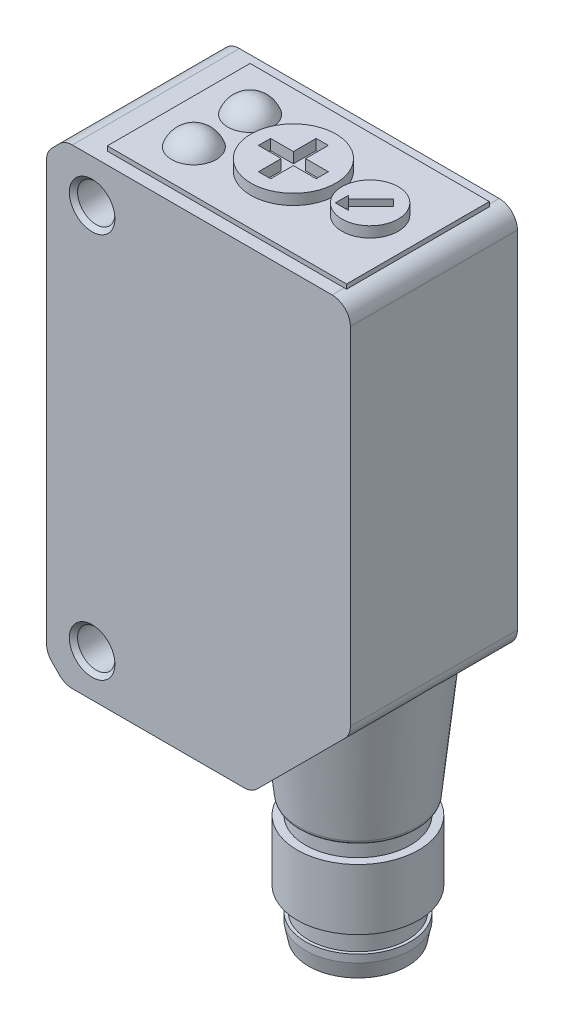
from build123d import *
from build123d.topology import SkipClean

# Parameters (mm, degrees)
BOSS_EXTRUDE1_DEPTH = 11
SKETCH3_R           = 2.9
SKETCH3_R_2         = 0.5
CUT_EXTRUDE1_DEPTH  = 4
SKETCH4_W           = 15.75
SKETCH4_H           = 9.4
BOSS_EXTRUDE2_DEPTH = 1
SKETCH5_W           = 15.75
SKETCH5_H           = 9.4
SKETCH5_R           = 1.85
SKETCH5_R_2         = 2.8
CUT_EXTRUDE2_DEPTH  = 1
SKETCH6_W           = 15.75
SKETCH6_H           = 9.4
BOSS_EXTRUDE3_DEPTH = 0.3
CUT_EXTRUDE3_DEPTH  = 0.2
CUT_EXTRUDE4_DEPTH  = 0.1


with BuildPart() as part:
    # Sketch1 → Boss-Extrude1 (new body)
    with BuildSketch(Plane.XY):
        with BuildLine():
            Line((-3, 26.502943725), (-3, -1.102943725))
            ThreePointArc((-3, -1.102943725), (-2.908655439, -1.562163844), (-2.648528137, -1.951471863))
            Line((-2.648528137, -1.951471863), (-2.151471863, -2.448528137))
            ThreePointArc((-2.151471863, -2.448528137), (-1.762163844, -2.708655439), (-1.302943725, -2.8))
            Line((-1.302943725, -2.8), (10.002943725, -2.8))
            ThreePointArc((10.002943725, -2.8), (10.462163844, -2.708655439), (10.851471863, -2.448528137))
            Line((10.851471863, -2.448528137), (16.648528137, 3.348528137))
            ThreePointArc((16.648528137, 3.348528137), (16.908655439, 3.737836156), (17, 4.197056275))
            Line((17, 4.197056275), (17, 27))
            ThreePointArc((17, 27), (16.648528137, 27.848528137), (15.8, 28.2))
            Line((15.8, 28.2), (-1.302943725, 28.2))
            ThreePointArc((-1.302943725, 28.2), (-1.762163844, 28.108655439), (-2.151471863, 27.848528137))
            Line((-2.151471863, 27.848528137), (-2.648528137, 27.351471863))
            ThreePointArc((-2.648528137, 27.351471863), (-2.908655439, 26.962163844), (-3, 26.502943725))
        make_face()
    extrude(amount=-BOSS_EXTRUDE1_DEPTH)

    # Sketch2 → Revolve1 (revolve)
    with BuildSketch(Plane.XY.offset(-5.5)):
        with BuildLine():
            Line((12, 4.7), (16.899094141, 4.7))
            Line((16.899094141, 4.7), (15.897307991, -4.831358539))
            ThreePointArc((15.897307991, -4.831358539), (15.799690604, -5.022943448), (15.598951422, -5.1))
            Line((15.598951422, -5.1), (15.45, -5.1))
            Line((15.45, -5.1), (15.45, -6.1))
            Line((15.45, -6.1), (16, -6.1))
            Line((16, -6.1), (16, -10.1))
            Line((16, -10.1), (15.25, -10.1))
            Line((15.25, -10.1), (15.25, -11.6))
            Line((15.25, -11.6), (15.45, -11.6))
            Line((15.45, -11.6), (15.45, -12.1))
            Line((15.45, -12.1), (15.25, -13.1))
            Line((15.25, -13.1), (12, -13.1))
            Line((12, -13.1), (12, 4.7))
        make_face()
    revolve(axis=Axis((12, -13.1, -5.5), (0, 1, 0)))

    # Sketch3 → Cut-Extrude1 (cut)
    with BuildSketch(Plane(origin=(0, -9.3, 0), x_dir=(1, 0, 0), z_dir=(0, 1, 0))):
        with Locations((12, 5.5)):
            Circle(SKETCH3_R)
        with Locations((13.41577974, 4.471375808)):
            Circle(SKETCH3_R_2, mode=Mode.SUBTRACT)
        with Locations((13.41577974, 6.528624192)):
            Circle(SKETCH3_R_2, mode=Mode.SUBTRACT)
        with Locations((11.45922026, 3.835651096)):
            Circle(SKETCH3_R_2, mode=Mode.SUBTRACT)
        with Locations((11.45922026, 7.164348904)):
            Circle(SKETCH3_R_2, mode=Mode.SUBTRACT)
    extrude(amount=-CUT_EXTRUDE1_DEPTH, mode=Mode.SUBTRACT)

    # Sketch4 → Boss-Extrude2 (add)
    with BuildSketch(Plane(origin=(0, 28.2, 0), x_dir=(1, 0, 0), z_dir=(0, 1, 0))):
        with Locations((8.075, 5.5)):
            Rectangle(SKETCH4_W, SKETCH4_H)
        Polygon((11.656497116, 4.356497116), (12.529289322, 4.356497116), (12.305025253, 4.580761184), (13.789949494, 6.065685425), (13.365685425, 6.489949494), (11.880761184, 5.005025253), (11.656497116, 5.229289322), align=None, mode=Mode.SUBTRACT)
        Polygon((5.85, 5.9), (5.85, 5.1), (7.35, 5.1), (7.35, 3.6), (8.15, 3.6), (8.15, 5.1), (9.65, 5.1), (9.65, 5.9), (8.15, 5.9), (8.15, 7.4), (7.35, 7.4), (7.35, 5.9), align=None, mode=Mode.SUBTRACT)
    extrude(amount=BOSS_EXTRUDE2_DEPTH)

    # Sketch5 → Cut-Extrude2 (cut)
    with BuildSketch(Plane(origin=(0, 28.2, 0), x_dir=(1, 0, 0), z_dir=(0, 1, 0))):
        with Locations((8.075, 5.5)):
            Rectangle(SKETCH5_W, SKETCH5_H)
        with Locations((12.8, 5.5)):
            Circle(SKETCH5_R, mode=Mode.SUBTRACT)
        with Locations((7.75, 5.5)):
            Circle(SKETCH5_R_2, mode=Mode.SUBTRACT)
    extrude(amount=CUT_EXTRUDE2_DEPTH, mode=Mode.SUBTRACT)

    # Sketch6 → Boss-Extrude3 (add)
    with BuildSketch(Plane(origin=(0, 28.2, 0), x_dir=(1, 0, 0), z_dir=(0, 1, 0))):
        with Locations((8.075, 5.5)):
            Rectangle(SKETCH6_W, SKETCH6_H)
    extrude(amount=BOSS_EXTRUDE3_DEPTH)

    # Sketch7 → Revolve2 (revolve)
    with SkipClean():  # the faces are left unmerged after this step: merging them gives an invalid solid
        with BuildSketch(Plane(origin=(3.1, 0, 0), x_dir=(0, 0, -1), z_dir=(1, 0, 0))):
            with BuildLine():
                Line((8.85, 28), (5.75, 28))
                ThreePointArc((5.75, 28), (7.3, 29.55), (8.85, 28))
            make_face()
        revolve(axis=Axis((3.1, 28, -8.85), (0, 0, 1)))

    # Sketch8 → Cut-Extrude3 (cut)
    with SkipClean():  # the faces are left unmerged after this step: merging them gives an invalid solid
        with BuildSketch(Plane(origin=(-2.8, 0, 0), x_dir=(0, 0, -1), z_dir=(1, 0, 0))):
            with BuildLine():
                Line((1.425, 19.925), (1.425, 2.675))
                ThreePointArc((1.425, 2.675), (1.659314575, 2.109314575), (2.225, 1.875))
                Line((2.225, 1.875), (8.775, 1.875))
                ThreePointArc((8.775, 1.875), (9.340685425, 2.109314575), (9.575, 2.675))
                Line((9.575, 2.675), (9.575, 19.925))
                ThreePointArc((9.575, 19.925), (9.340685425, 20.490685425), (8.775, 20.725))
                Line((8.775, 20.725), (2.225, 20.725))
                ThreePointArc((2.225, 20.725), (1.659314575, 20.490685425), (1.425, 19.925))
            make_face()
        extrude(amount=-CUT_EXTRUDE3_DEPTH, mode=Mode.SUBTRACT)

    # Sketch9 → Cut-Extrude4 (cut)
    with SkipClean():  # the faces are left unmerged after this step: merging them gives an invalid solid
        with BuildSketch(Plane.XY.offset(-11)):
            with BuildLine():
                Line((4.4, 0.2), (9.091673888, 0.2))
                ThreePointArc((9.091673888, 0.2), (9.244747261, 0.230448187), (9.3745166, 0.317157288))
                Line((9.3745166, 0.317157288), (13.882842712, 4.8254834))
                ThreePointArc((13.882842712, 4.8254834), (13.969551813, 4.955252739), (14, 5.108326112))
                Line((14, 5.108326112), (14, 24.8))
                ThreePointArc((14, 24.8), (13.882842712, 25.082842712), (13.6, 25.2))
                Line((13.6, 25.2), (4.4, 25.2))
                ThreePointArc((4.4, 25.2), (4.117157288, 25.082842712), (4, 24.8))
                Line((4, 24.8), (4, 0.6))
                ThreePointArc((4, 0.6), (4.117157288, 0.317157288), (4.4, 0.2))
            make_face()
        extrude(amount=CUT_EXTRUDE4_DEPTH, mode=Mode.SUBTRACT)

    # Sketch10 → Cut-Revolve1 (revolve, cut)
    with SkipClean():  # the faces are left unmerged after this step: merging them gives an invalid solid
        with BuildSketch(Plane(origin=(0, 0, 0), x_dir=(0, 0, -1), z_dir=(1, 0, 0))):
            Polygon((0, 0), (0, 1.5), (0.2705, 1.2295), (10.7295, 1.2295), (11, 1.5), (11, 0), align=None)
        revolve(axis=Axis((0, 0, -11), (0, 0, 1)), mode=Mode.SUBTRACT)

    # Sketch11 → Cut-Revolve2 (revolve, cut)
    with SkipClean():  # the faces are left unmerged after this step: merging them gives an invalid solid
        with BuildSketch(Plane(origin=(0, 0, 0), x_dir=(0, 0, -1), z_dir=(1, 0, 0))):
            Polygon((0, 25.4), (0, 26.9), (0.2705, 26.6295), (10.7295, 26.6295), (11, 26.9), (11, 25.4), align=None)
        revolve(axis=Axis((0, 25.4, -11), (0, 0, 1)), mode=Mode.SUBTRACT)

    # Sketch12 → Revolve3 (revolve)
    with SkipClean():  # the faces are left unmerged after this step: merging them gives an invalid solid
        with BuildSketch(Plane(origin=(3.1, 0, 0), x_dir=(0, 0, -1), z_dir=(1, 0, 0))):
            with BuildLine():
                Line((5.15, 28), (2.05, 28))
                ThreePointArc((2.05, 28), (3.6, 29.55), (5.15, 28))
            make_face()
        revolve(axis=Axis((3.1, 28, -5.15), (0, 0, 1)))


solid = part.part
